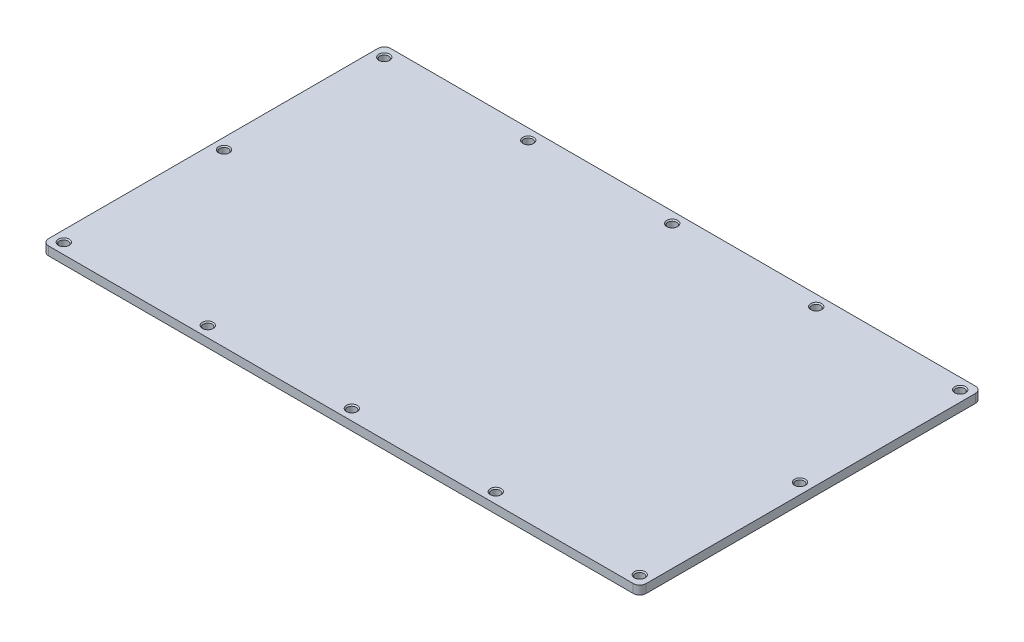
from build123d import *

# Parameters (mm, degrees)
SKETCH1_W                 = 276
SKETCH1_H                 = 158
BOSS_EXTRUDE1_DEPTH       = 4
SKETCH2_R                 = 2
CUT_EXTRUDE1_DEPTH        = 10
LPATTERN1_COUNT           = 2
LPATTERN1_PITCH           = 74
LPATTERN1_COL_COUNT       = 2
LPATTERN1_COL_PITCH       = 74
LPATTERN2_COUNT           = 5
LPATTERN2_PITCH           = 66.5
LPATTERN2_COPY_1_SKETCH_R = 2
LPATTERN2_COPY_1_DEPTH    = 10
LPATTERN2_COPY_2_SKETCH_R = 2
LPATTERN2_COPY_2_DEPTH    = 10
LPATTERN2_COPY_3_SKETCH_R = 2
LPATTERN2_COPY_3_DEPTH    = 10
LPATTERN2_COPY_4_SKETCH_R = 2
LPATTERN2_COPY_4_DEPTH    = 10
LPATTERN2_COPY_5_SKETCH_R = 2
LPATTERN2_COPY_5_DEPTH    = 10
LPATTERN2_COPY_6_SKETCH_R = 2
LPATTERN2_COPY_6_DEPTH    = 10
LPATTERN2_COPY_7_SKETCH_R = 2
LPATTERN2_COPY_7_DEPTH    = 10
LPATTERN2_COPY_8_SKETCH_R = 2
LPATTERN2_COPY_8_DEPTH    = 10
FILLET1_R                 = 3
SKETCH3_W                 = 200.387432082
SKETCH3_H                 = 94.542877392
BOSS_EXTRUDE2_DEPTH       = 4
CHAMFER1_SIZE             = 0.5
BOSS_EXTRUDE3_DEPTH       = 5
CUT_EXTRUDE2_DEPTH        = 2
SKETCH6_W                 = 10
SKETCH6_H                 = 20
BOSS_EXTRUDE4_DEPTH       = 3
CHAMFER2_SIZE             = 0.5
CHAMFER4_SIZE             = 2


with BuildPart() as part:
    # Sketch1 → Boss-Extrude1 (new body)
    with BuildSketch(Plane(origin=(0, 0, 0), x_dir=(1, 0, 0), z_dir=(0, 1, 0))):
        with Locations((138, 79)):
            Rectangle(SKETCH1_W, SKETCH1_H)
    extrude(amount=BOSS_EXTRUDE1_DEPTH)

    # Sketch2 → Cut-Extrude1 (cut)
    with BuildSketch(Plane(origin=(0, 0, 0), x_dir=(1, 0, 0), z_dir=(0, 1, 0))):
        with Locations(Location((5, 79, 0), (0, 0, 90))):
            Circle(SKETCH2_R)
    cut_extrude1 = extrude(amount=CUT_EXTRUDE1_DEPTH, mode=Mode.SUBTRACT)

    # LPattern1: Cut-Extrude1 ×2
    with Locations(*[(0, 0, i * LPATTERN1_PITCH) for i in range(1, LPATTERN1_COUNT)]):
        add(cut_extrude1, mode=Mode.SUBTRACT)

    # LPattern1 col: Cut-Extrude1 ×2
    with Locations(*[(0, 0, -i * LPATTERN1_COL_PITCH) for i in range(1, LPATTERN1_COL_COUNT)]):
        add(cut_extrude1, mode=Mode.SUBTRACT)

    # LPattern2: Cut-Extrude1 ×5
    with Locations(*[(i * LPATTERN2_PITCH, 0, 0) for i in range(1, LPATTERN2_COUNT)]):
        add(cut_extrude1, mode=Mode.SUBTRACT)

    # LPattern2 copy 1 sketch → LPattern2 copy 1 (cut)
    with BuildSketch(Plane(origin=(66.5, 0, 74), x_dir=(1, 0, 0), z_dir=(0, 1, 0))):
        with Locations(Location((5, 79, 0), (0, 0, 90))):
            Circle(LPATTERN2_COPY_1_SKETCH_R)
    extrude(amount=LPATTERN2_COPY_1_DEPTH, mode=Mode.SUBTRACT)

    # LPattern2 copy 2 sketch → LPattern2 copy 2 (cut)
    with BuildSketch(Plane(origin=(133, 0, 74), x_dir=(1, 0, 0), z_dir=(0, 1, 0))):
        with Locations(Location((5, 79, 0), (0, 0, 90))):
            Circle(LPATTERN2_COPY_2_SKETCH_R)
    extrude(amount=LPATTERN2_COPY_2_DEPTH, mode=Mode.SUBTRACT)

    # LPattern2 copy 3 sketch → LPattern2 copy 3 (cut)
    with BuildSketch(Plane(origin=(199.5, 0, 74), x_dir=(1, 0, 0), z_dir=(0, 1, 0))):
        with Locations(Location((5, 79, 0), (0, 0, 90))):
            Circle(LPATTERN2_COPY_3_SKETCH_R)
    extrude(amount=LPATTERN2_COPY_3_DEPTH, mode=Mode.SUBTRACT)

    # LPattern2 copy 4 sketch → LPattern2 copy 4 (cut)
    with BuildSketch(Plane(origin=(266, 0, 74), x_dir=(1, 0, 0), z_dir=(0, 1, 0))):
        with Locations(Location((5, 79, 0), (0, 0, 90))):
            Circle(LPATTERN2_COPY_4_SKETCH_R)
    extrude(amount=LPATTERN2_COPY_4_DEPTH, mode=Mode.SUBTRACT)

    # LPattern2 copy 5 sketch → LPattern2 copy 5 (cut)
    with BuildSketch(Plane(origin=(66.5, 0, -74), x_dir=(1, 0, 0), z_dir=(0, 1, 0))):
        with Locations(Location((5, 79, 0), (0, 0, 90))):
            Circle(LPATTERN2_COPY_5_SKETCH_R)
    extrude(amount=LPATTERN2_COPY_5_DEPTH, mode=Mode.SUBTRACT)

    # LPattern2 copy 6 sketch → LPattern2 copy 6 (cut)
    with BuildSketch(Plane(origin=(133, 0, -74), x_dir=(1, 0, 0), z_dir=(0, 1, 0))):
        with Locations(Location((5, 79, 0), (0, 0, 90))):
            Circle(LPATTERN2_COPY_6_SKETCH_R)
    extrude(amount=LPATTERN2_COPY_6_DEPTH, mode=Mode.SUBTRACT)

    # LPattern2 copy 7 sketch → LPattern2 copy 7 (cut)
    with BuildSketch(Plane(origin=(199.5, 0, -74), x_dir=(1, 0, 0), z_dir=(0, 1, 0))):
        with Locations(Location((5, 79, 0), (0, 0, 90))):
            Circle(LPATTERN2_COPY_7_SKETCH_R)
    extrude(amount=LPATTERN2_COPY_7_DEPTH, mode=Mode.SUBTRACT)

    # LPattern2 copy 8 sketch → LPattern2 copy 8 (cut)
    with BuildSketch(Plane(origin=(266, 0, -74), x_dir=(1, 0, 0), z_dir=(0, 1, 0))):
        with Locations(Location((5, 79, 0), (0, 0, 90))):
            Circle(LPATTERN2_COPY_8_SKETCH_R)
    extrude(amount=LPATTERN2_COPY_8_DEPTH, mode=Mode.SUBTRACT)

    # Fillet1
    fillet1_edges = [part.edges().sort_by_distance(p)[0] for p in [
        (0, 2, 0),
        (0, 2, -158),
        (276, 2, -158),
        (276, 2, 0),
    ]]
    fillet(fillet1_edges, radius=FILLET1_R)

    # Sketch3 → Boss-Extrude2 (add)
    with BuildSketch(Plane(origin=(0, 0, 0), x_dir=(1, 0, 0), z_dir=(0, 1, 0))):
        with Locations((130.827781715, 79.217339948)):
            Rectangle(SKETCH3_W, SKETCH3_H)
    extrude(amount=BOSS_EXTRUDE2_DEPTH)

    # Chamfer1
    chamfer1_edges = [part.edges().sort_by_distance(p)[0] for p in [
        (5, 4, -77),
        (5, 4, -3),
        (5, 4, -151),
        (71.5, 4, -3),
        (138, 4, -3),
        (204.5, 4, -3),
        (271, 4, -3),
        (271, 4, -77),
        (71.5, 4, -151),
        (138, 4, -151),
        (204.5, 4, -151),
        (271, 4, -151),
    ]]
    chamfer(chamfer1_edges, length=CHAMFER1_SIZE)

    # Sketch4 → Boss-Extrude3 (add)
    with BuildSketch(Plane.XZ):
        with BuildLine():
            Line((10.1, -15.1), (10.1, -142.9))
            ThreePointArc((10.1, -142.9), (11.564466094, -146.435533906), (15.1, -147.9))
            Line((15.1, -147.9), (260.9, -147.9))
            ThreePointArc((260.9, -147.9), (264.435533906, -146.435533906), (265.9, -142.9))
            Line((265.9, -142.9), (265.9, -15.1))
            ThreePointArc((265.9, -15.1), (264.435533906, -11.564466094), (260.9, -10.1))
            Line((260.9, -10.1), (15.1, -10.1))
            ThreePointArc((15.1, -10.1), (11.564466094, -11.564466094), (10.1, -15.1))
        make_face()
        with BuildLine():
            Line((15.1, -20.1), (15.1, -137.9))
            ThreePointArc((15.1, -137.9), (16.564466094, -141.435533906), (20.1, -142.9))
            Line((20.1, -142.9), (255.9, -142.9))
            ThreePointArc((255.9, -142.9), (259.435533906, -141.435533906), (260.9, -137.9))
            Line((260.9, -137.9), (260.9, -20.1))
            ThreePointArc((260.9, -20.1), (259.435533906, -16.564466094), (255.9, -15.1))
            Line((255.9, -15.1), (20.1, -15.1))
            ThreePointArc((20.1, -15.1), (16.564466094, -16.564466094), (15.1, -20.1))
        make_face(mode=Mode.SUBTRACT)
    extrude(amount=BOSS_EXTRUDE3_DEPTH)

    # Sketch5 → Cut-Extrude2 (cut)
    with BuildSketch(Plane.XZ):
        with BuildLine():
            Line((40.910440594, -142.9), (235.089559406, -142.9))
            ThreePointArc((235.089559406, -142.9), (239.951204492, -139.068078365), (237.361072383, -133.445762827))
            Line((237.361072383, -133.445762827), (140.271512977, -83.933313096))
            ThreePointArc((140.271512977, -83.933313096), (138, -83.387550269), (135.728487023, -83.933313096))
            Line((135.728487023, -83.933313096), (38.638927617, -133.445762827))
            ThreePointArc((38.638927617, -133.445762827), (36.048795508, -139.068078365), (40.910440594, -142.9))
        make_face()
        with BuildLine():
            Line((22.371512977, -134.19176996), (121.863352514, -83.454237173))
            ThreePointArc((121.863352514, -83.454237173), (124.591839537, -79), (121.863352514, -74.545762827))
            Line((121.863352514, -74.545762827), (22.371512977, -23.80823004))
            ThreePointArc((22.371512977, -23.80823004), (17.488253926, -23.998808873), (15.1, -28.262467213))
            Line((15.1, -28.262467213), (15.1, -129.737532787))
            ThreePointArc((15.1, -129.737532787), (17.488253926, -134.001191127), (22.371512977, -134.19176996))
        make_face()
        with BuildLine():
            Line((38.638927617, -24.554237173), (135.728487023, -74.066686904))
            ThreePointArc((135.728487023, -74.066686904), (138, -74.612449731), (140.271512977, -74.066686904))
            Line((140.271512977, -74.066686904), (237.361072383, -24.554237173))
            ThreePointArc((237.361072383, -24.554237173), (239.951204492, -18.931921635), (235.089559406, -15.1))
            Line((235.089559406, -15.1), (40.910440594, -15.1))
            ThreePointArc((40.910440594, -15.1), (36.048795508, -18.931921635), (38.638927617, -24.554237173))
        make_face()
        with BuildLine():
            Line((253.628487023, -134.19176996), (154.136647486, -83.454237173))
            ThreePointArc((154.136647486, -83.454237173), (151.408160463, -79), (154.136647486, -74.545762827))
            Line((154.136647486, -74.545762827), (253.628487023, -23.80823004))
            ThreePointArc((253.628487023, -23.80823004), (258.511746074, -23.998808873), (260.9, -28.262467213))
            Line((260.9, -28.262467213), (260.9, -129.737532787))
            ThreePointArc((260.9, -129.737532787), (258.511746074, -134.001191127), (253.628487023, -134.19176996))
        make_face()
    extrude(amount=-CUT_EXTRUDE2_DEPTH, mode=Mode.SUBTRACT)

    # Sketch6 → Boss-Extrude4 (add)
    with BuildSketch(Plane.XZ):
        with BuildLine():
            ThreePointArc((113, -142.9), (127.142135624, -137.042135624), (133, -122.9))
            Line((133, -122.9), (133, -142.9))
            Line((133, -142.9), (113, -142.9))
        make_face()
        with Locations((138, -132.9)):
            Rectangle(SKETCH6_W, SKETCH6_H)
        with BuildLine():
            Line((135.728487023, -83.933313096), (125.728487023, -89.03298087))
            ThreePointArc((125.728487023, -89.03298087), (130.611746074, -89.223559703), (133, -93.487218044))
            Line((133, -93.487218044), (133, -122.9))
            Line((133, -122.9), (143, -122.9))
            Line((143, -122.9), (143, -93.487218044))
            ThreePointArc((143, -93.487218044), (145.388253926, -89.223559703), (150.271512977, -89.03298087))
            Line((150.271512977, -89.03298087), (140.271512977, -83.933313096))
            ThreePointArc((140.271512977, -83.933313096), (138, -83.387550269), (135.728487023, -83.933313096))
        make_face()
        with BuildLine():
            Line((135.728487023, -74.066686904), (125.728487023, -68.96701913))
            Line((125.728487023, -68.96701913), (113, -62.475913621))
            Line((113, -62.475913621), (110.613147943, -64.512781956))
            Line((110.613147943, -64.512781956), (122.461258792, -72.009957731))
            Line((122.461258792, -72.009957731), (128, -82.174730427))
            Line((128, -82.174730427), (113, -91.109371395))
            Line((113, -91.109371395), (113, -95.524086379))
            Line((113, -95.524086379), (125.728487023, -89.03298087))
            Line((125.728487023, -89.03298087), (135.728487023, -83.933313096))
            ThreePointArc((135.728487023, -83.933313096), (138, -83.387550269), (140.271512977, -83.933313096))
            Line((140.271512977, -83.933313096), (150.271512977, -89.03298087))
            Line((150.271512977, -89.03298087), (163, -95.524086379))
            Line((163, -95.524086379), (165.532803615, -91.72866376))
            Line((165.532803615, -91.72866376), (149.718388123, -83.663837255))
            Line((149.718388123, -83.663837255), (150.271512977, -73.75803966))
            Line((150.271512977, -73.75803966), (164.221383124, -63.907160193))
            Line((164.221383124, -63.907160193), (163, -62.475913621))
            Line((163, -62.475913621), (150.271512977, -68.96701913))
            Line((150.271512977, -68.96701913), (140.271512977, -74.066686904))
            ThreePointArc((140.271512977, -74.066686904), (138, -74.612449731), (135.728487023, -74.066686904))
        make_face()
        with BuildLine():
            Line((143, -15.1), (133, -15.1))
            Line((133, -15.1), (133, -35.1))
            Line((133, -35.1), (133, -64.512781956))
            ThreePointArc((133, -64.512781956), (130.611746074, -68.776440297), (125.728487023, -68.96701913))
            Line((125.728487023, -68.96701913), (135.728487023, -74.066686904))
            ThreePointArc((135.728487023, -74.066686904), (138, -74.612449731), (140.271512977, -74.066686904))
            Line((140.271512977, -74.066686904), (150.271512977, -68.96701913))
            ThreePointArc((150.271512977, -68.96701913), (145.388253926, -68.776440297), (143, -64.512781956))
            Line((143, -64.512781956), (143, -35.1))
            Line((143, -35.1), (143, -15.1))
        make_face()
        with BuildLine():
            Line((133, -35.1), (133, -15.1))
            Line((133, -15.1), (113, -15.1))
            ThreePointArc((113, -15.1), (127.142135624, -20.957864376), (133, -35.1))
        make_face()
        with BuildLine():
            Line((163, -15.1), (143, -15.1))
            Line((143, -15.1), (143, -35.1))
            ThreePointArc((143, -35.1), (148.857864376, -20.957864376), (163, -15.1))
        make_face()
        with BuildLine():
            ThreePointArc((143, -122.9), (148.857864376, -137.042135624), (163, -142.9))
            Line((163, -142.9), (143, -142.9))
            Line((143, -142.9), (143, -122.9))
        make_face()
    extrude(amount=-BOSS_EXTRUDE4_DEPTH)

    # Chamfer2
    chamfer2_edges = [part.edges().sort_by_distance(p)[0] for p in [
        (11.564466094, -5, -11.564466094),
        (10.1, -5, -79),
        (11.564466094, -5, -146.435533906),
        (264.435533906, -5, -146.435533906),
        (264.435533906, -5, -11.564466094),
        (138, -5, -10.1),
        (138, -5, -147.9),
        (265.9, -5, -79),
    ]]
    chamfer(chamfer2_edges, length=CHAMFER2_SIZE)

    # Chamfer4
    chamfer4_edges = [part.edges().sort_by_distance(p)[0] for p in [
        (199.044779703, 2, -15.1),
        (239.951204492, 2, -18.931921635),
        (193.81629268, 2, -46.760628151),
        (145.388253926, 2, -68.776440297),
        (143, 2, -49.806390978),
        (148.857864376, 2, -20.957864376),
        (82.18370732, 2, -46.760628151),
        (36.048795508, 2, -18.931921635),
        (76.955220297, 2, -15.1),
        (127.142135624, 2, -20.957864376),
        (133, 2, -49.806390978),
        (130.611746074, 2, -68.776440297),
        (72.117432745, 2, -49.176996433),
        (124.591839537, 2, -79),
        (72.117432745, 2, -108.823003567),
        (17.488253926, 2, -134.001191127),
        (15.1, 2, -79),
        (17.488253926, 2, -23.998808873),
        (76.955220297, 2, -142.9),
        (36.048795508, 2, -139.068078365),
        (82.18370732, 2, -111.239371849),
        (130.611746074, 2, -89.223559703),
        (133, 2, -108.193609022),
        (127.142135624, 2, -137.042135624),
        (193.81629268, 2, -111.239371849),
        (239.951204492, 2, -139.068078365),
        (199.044779703, 2, -142.9),
        (148.857864376, 2, -137.042135624),
        (143, 2, -108.193609022),
        (145.388253926, 2, -89.223559703),
        (258.511746074, 2, -23.998808873),
        (203.882567255, 2, -49.176996433),
        (260.9, 2, -79),
        (151.408160463, 2, -79),
        (258.511746074, 2, -134.001191127),
        (203.882567255, 2, -108.823003567),
    ]]
    chamfer(chamfer4_edges, length=CHAMFER4_SIZE - 0.0001)  # a hair under: the kernel refuses the full size


solid = part.part
